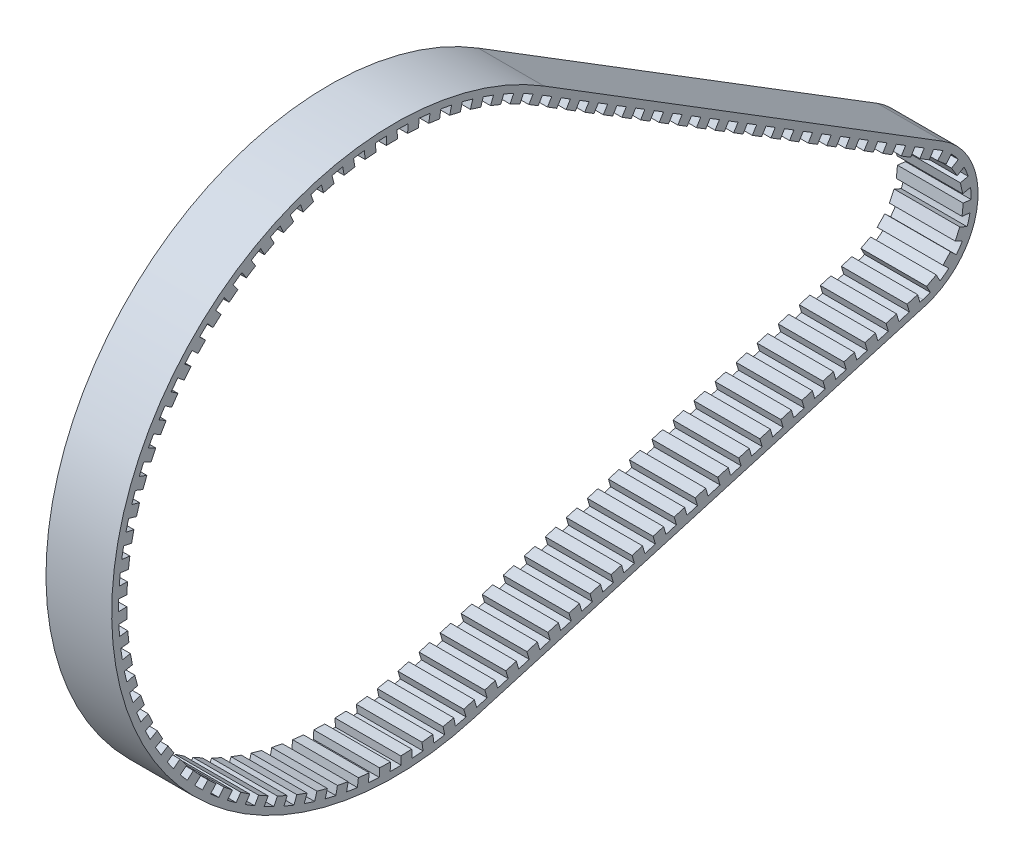
from build123d import *

# Parameters (mm, degrees)
BOSS_EXTRUDE1_DEPTH = 3
BOSS_EXTRUDE2_DEPTH = 6
CRVPATTERN1_START   = -3
CRVPATTERN1_DEPTH   = 6


# Read off the part's stored shape, not the designer's step: CrvPattern1
with BuildPart() as part:
    # Sketch1 → Boss-Extrude1 (new, symmetric)
    with BuildSketch(Plane(origin=(0, 0, 0), x_dir=(0, 0, -1), z_dir=(1, 0, 0))):
        with BuildLine():
            Line((48.384784727, -12.821103965), (7.22594026, -24.809098882))
            ThreePointArc((7.22594026, -24.809098882), (-25.602380983, 3.496239123), (13.61314313, 21.963331581))
            Line((13.61314313, 21.963331581), (50.050796621, -0.621174348))
            ThreePointArc((50.050796621, -0.621174348), (53.178020427, -7.261944725), (48.384784727, -12.821103965))
        make_face()
        with BuildLine():
            Line((13.281243742, 21.427847877), (49.718897234, -1.156658051))
            ThreePointArc((49.718897234, -1.156658051), (52.55381377, -7.176703601), (48.208610487, -12.216238165))
            Line((48.208610487, -12.216238165), (7.04976602, -24.204233081))
            ThreePointArc((7.04976602, -24.204233081), (-24.978174326, 3.410997999), (13.281243742, 21.427847877))
        make_face(mode=Mode.SUBTRACT)
    extrude(amount=BOSS_EXTRUDE1_DEPTH, both=True)

    # Sketch2 → Boss-Extrude2 (add)
    with BuildSketch(Plane(origin=(3, 0, 0), x_dir=(0, 0, -1), z_dir=(1, 0, 0))):
        Polygon((27.629188254, -18.210235623), (27.419457015, -17.490157289), (28.379561461, -17.210515638), (28.5892927, -17.930593972), align=None)
    extrude(amount=-BOSS_EXTRUDE2_DEPTH)

    # CrvPattern1 outline → CrvPattern1 (add)
    with BuildSketch(Plane.YZ.offset(CRVPATTERN1_START)):
        Polygon((-18.489877274, -26.669083808), (-17.76979894, -26.45935257), (-18.04944059, -25.499248124), (-18.769518925, -25.708979362), align=None)
        Polygon((-17.610652259, -29.687760899), (-17.331010608, -30.647865345), (-16.610932274, -30.438134107), (-16.890573925, -29.478029661), align=None)
        Polygon((-17.051368958, -31.607969791), (-16.771727307, -32.568074237), (-16.051648972, -32.358342998), (-16.331290623, -31.398238553), align=None)
        Polygon((-16.492085656, -33.528178683), (-16.212444005, -34.488283128), (-15.49236567, -34.27855189), (-15.772007321, -33.318447444), align=None)
        Polygon((-15.932802354, -35.448387574), (-15.653160703, -36.40849202), (-14.933082368, -36.198760782), (-15.212724019, -35.238656336), align=None)
        Polygon((-15.373519052, -37.368596466), (-15.093877401, -38.328700912), (-14.373799067, -38.118969674), (-14.653440717, -37.158865228), align=None)
        Polygon((-14.81423575, -39.288805358), (-14.534594099, -40.248909804), (-13.814515765, -40.039178566), (-14.094157416, -39.07907412), align=None)
        Polygon((-14.254952448, -41.20901425), (-13.975310797, -42.169118696), (-13.255232463, -41.959387458), (-13.534874114, -40.999283012), align=None)
        Polygon((-13.695669147, -43.129223142), (-13.416027496, -44.089327588), (-12.695949161, -43.879596349), (-12.975590812, -42.919491903), align=None)
        Polygon((-13.136385845, -45.049432033), (-12.856744194, -46.009536479), (-12.136665859, -45.799805241), (-12.41630751, -44.839700795), align=None)
        Polygon((-12.577102543, -46.969640925), (-12.297460892, -47.929745371), (-11.577382557, -47.720014133), (-11.857024208, -46.759909687), align=None)
        with BuildLine():
            ThreePointArc((-11.978971308, -48.87629586), (-11.76563246, -49.328961834), (-11.515966098, -49.762651418))
            Line((-11.515966098, -49.762651418), (-10.869363186, -49.424885705))
            Line((-10.869363186, -49.424885705), (-11.332368397, -48.538530147))
            Line((-11.332368397, -48.538530147), (-11.978971308, -48.87629586))
        make_face()
        with BuildLine():
            ThreePointArc((-10.916070269, -50.559938706), (-10.568518691, -50.919977382), (-10.192669716, -51.250367297))
            Line((-10.192669716, -51.250367297), (-9.688996971, -50.722641262))
            Line((-9.688996971, -50.722641262), (-10.412397524, -50.032212671))
            Line((-10.412397524, -50.032212671), (-10.916070269, -50.559938706))
        make_face()
        with BuildLine():
            ThreePointArc((-9.368284022, -51.81244403), (-8.923427297, -52.04162178), (-8.461308281, -52.233626893))
            Line((-8.461308281, -52.233626893), (-8.154052278, -51.571981405))
            Line((-8.154052278, -51.571981405), (-9.06102802, -51.150798542))
            Line((-9.06102802, -51.150798542), (-9.368284022, -51.81244403))
        make_face()
        with BuildLine():
            ThreePointArc((-7.499976804, -52.500804392), (-7.005055651, -52.57478412), (-6.505740451, -52.60801481))
            Line((-6.505740451, -52.60801481), (-6.427529661, -51.882712063))
            Line((-6.427529661, -51.882712063), (-7.421766015, -51.775501645))
            Line((-7.421766015, -51.775501645), (-7.499976804, -52.500804392))
        make_face()
        with BuildLine():
            ThreePointArc((-5.509549972, -52.551920667), (-5.017121608, -52.462846233), (-4.533634058, -52.33377363))
            Line((-4.533634058, -52.33377363), (-4.692773929, -51.621835779))
            Line((-4.692773929, -51.621835779), (-5.668689842, -51.839982815))
            Line((-5.668689842, -51.839982815), (-5.509549972, -52.551920667))
        make_face()
        with BuildLine():
            ThreePointArc((-3.608373142, -51.960364656), (-3.170730068, -51.717695153), (-2.754413216, -51.440025878))
            Line((-2.754413216, -51.440025878), (-3.134004188, -50.817055818))
            Line((-3.134004188, -50.817055818), (-3.987964115, -51.337394596))
            Line((-3.987964115, -51.337394596), (-3.608373142, -51.960364656))
        make_face()
        with BuildLine():
            ThreePointArc((-1.998338199, -50.788955534), (-1.661955094, -50.41846079), (-1.35701892, -50.021681408))
            Line((-1.35701892, -50.021681408), (-1.916751049, -49.553834269))
            Line((-1.916751049, -49.553834269), (-2.558070328, -50.321108394))
            Line((-2.558070328, -50.321108394), (-1.998338199, -50.788955534))
        make_face()
        Polygon((-0.821432921, -49.178047805), (-0.294608496, -48.328073672), (-0.932089095, -47.932955354), (-1.45891352, -48.782929486), align=None)
        Polygon((0.232215928, -47.47809954), (0.759040353, -46.628125407), (0.121559754, -46.233007089), (-0.405264671, -47.082981221), align=None)
        Polygon((1.285864777, -45.778151275), (1.812689202, -44.928177143), (1.175208603, -44.533058824), (0.648384178, -45.383032957), align=None)
        Polygon((2.339513626, -44.07820301), (2.866338051, -43.228228878), (2.228857452, -42.833110559), (1.702033027, -43.683084692), align=None)
        Polygon((3.393162476, -42.378254745), (3.9199869, -41.528280613), (3.282506301, -41.133162295), (2.755681876, -41.983136427), align=None)
        Polygon((4.446811325, -40.678306481), (4.973635749, -39.828332348), (4.33615515, -39.43321403), (3.809330725, -40.283188162), align=None)
        Polygon((5.500460174, -38.978358216), (6.027284598, -38.128384084), (5.389803999, -37.733265765), (4.862979574, -38.583239898), align=None)
        Polygon((6.554109023, -37.278409951), (7.080933447, -36.428435819), (6.443452848, -36.0333175), (5.916628423, -36.883291633), align=None)
        Polygon((7.607757872, -35.578461686), (8.134582296, -34.728487554), (7.497101697, -34.333369236), (6.970277272, -35.183343368), align=None)
        Polygon((8.661406721, -33.878513422), (9.188231145, -33.028539289), (8.550750546, -32.633420971), (8.023926122, -33.483395103), align=None)
        Polygon((9.71505557, -32.178565157), (10.241879994, -31.328591024), (9.604399395, -30.933472706), (9.077574971, -31.783446838), align=None)
        Polygon((10.768704419, -30.478616892), (11.295528843, -29.62864276), (10.658048244, -29.233524441), (10.13122382, -30.083498574), align=None)
        Polygon((11.822353268, -28.778668627), (12.349177692, -27.928694495), (11.711697093, -27.533576177), (11.184872669, -28.383550309), align=None)
        Polygon((12.876002117, -27.078720363), (13.402826542, -26.22874623), (12.765345942, -25.833627912), (12.238521518, -26.683602044), align=None)
        Polygon((13.929650966, -25.378772098), (14.456475391, -24.528797965), (13.818994791, -24.133679647), (13.292170367, -24.983653779), align=None)
        Polygon((14.983299815, -23.678823833), (15.510124239, -22.828849701), (14.87264364, -22.433731382), (14.345819216, -23.283705515), align=None)
        Polygon((16.036948664, -21.978875568), (16.563773088, -21.128901436), (15.926292489, -20.733783117), (15.399468065, -21.58375725), align=None)
        Polygon((17.090597513, -20.278927304), (17.617421938, -19.428953171), (16.979941339, -19.033834853), (16.453116914, -19.883808985), align=None)
        Polygon((18.144246362, -18.578979039), (18.671070787, -17.729004906), (18.033590188, -17.333886588), (17.506765763, -18.18386072), align=None)
        Polygon((19.197895211, -16.879030774), (19.724719635, -16.029056642), (19.087239037, -15.633938323), (18.560414612, -16.483912456), align=None)
        Polygon((20.25154406, -15.179082509), (20.778368485, -14.329108377), (20.140887886, -13.933990058), (19.614063461, -14.783964191), align=None)
        with BuildLine():
            ThreePointArc((21.427847877, -13.281243742), (21.627452786, -12.953663033), (21.822050163, -12.623083088))
            Line((21.822050163, -12.623083088), (21.184660236, -12.237310599))
            Line((21.184660236, -12.237310599), (20.666873423, -13.092820282))
            Line((20.666873423, -13.092820282), (21.305183386, -13.47914961))
            Line((21.305183386, -13.47914961), (21.427847877, -13.281243742))
        make_face()
        with BuildLine():
            ThreePointArc((22.305439851, -11.747827588), (22.534051701, -11.303124078), (22.753798601, -10.853973891))
            Line((22.753798601, -10.853973891), (22.087840803, -10.519928167))
            Line((22.087840803, -10.519928167), (21.639482054, -11.413781864))
            Line((21.639482054, -11.413781864), (22.305439851, -11.747827588))
        make_face()
        with BuildLine():
            ThreePointArc((23.166303548, -9.943162469), (23.358953421, -9.481740085), (23.542413826, -9.016587561))
            Line((23.542413826, -9.016587561), (22.85207738, -8.736369923))
            Line((22.85207738, -8.736369923), (22.475967103, -9.662944831))
            Line((22.475967103, -9.662944831), (23.166303548, -9.943162469))
        make_face()
        with BuildLine():
            ThreePointArc((23.881439164, -8.075949692), (24.036915192, -7.600711021), (24.182935039, -7.122482212))
            Line((24.182935039, -7.122482212), (23.47256252, -6.897855374))
            Line((23.47256252, -6.897855374), (23.171066644, -7.851322855))
            Line((23.171066644, -7.851322855), (23.881439164, -8.075949692))
        make_face()
        with BuildLine():
            ThreePointArc((24.446348123, -6.157934998), (24.563672281, -5.671869538), (24.671333031, -5.18357275))
            Line((24.671333031, -5.18357275), (23.945393049, -5.015949732))
            Line((23.945393049, -5.015949732), (23.720408141, -5.99031198))
            Line((23.720408141, -5.99031198), (24.446348123, -6.157934998))
        make_face()
        with BuildLine():
            ThreePointArc((24.857476854, -4.201183694), (24.935911113, -3.707349048), (25.004535523, -3.212055922))
            Line((25.004535523, -3.212055922), (24.267594619, -3.102491161))
            Line((24.267594619, -3.102491161), (24.12053595, -4.091618932))
            Line((24.12053595, -4.091618932), (24.857476854, -4.201183694))
        make_face()
        with BuildLine():
            ThreePointArc((25.112239145, -2.218004762), (25.151290111, -1.719507408), (25.180446499, -1.220333595))
            Line((25.180446499, -1.220333595), (24.437140414, -1.169516309))
            Line((24.437140414, -1.169516309), (24.368933059, -2.167187475))
            Line((24.368933059, -2.167187475), (25.112239145, -2.218004762))
        make_face()
        with BuildLine():
            ThreePointArc((25.209032407, -0.220873428), (25.208454431, 0.279150827), (25.197959388, 0.779065264))
            Line((25.197959388, 0.779065264), (24.452963902, 0.770815409))
            Line((24.452963902, 0.770815409), (24.464036922, -0.229123284))
            Line((24.464036922, -0.229123284), (25.209032407, -0.220873428))
        make_face()
        with BuildLine():
            ThreePointArc((25.147247762, 1.777647314), (25.107044479, 2.276053058), (25.056964023, 2.773563398))
            Line((25.056964023, 2.773563398), (24.314965547, 2.706298297))
            Line((24.314965547, 2.706298297), (24.405249285, 1.710382212))
            Line((24.405249285, 1.710382212), (25.147247762, 1.777647314))
        make_face()
        with BuildLine():
            ThreePointArc((24.927273867, 3.764985732), (24.847698176, 4.258637734), (24.75834734, 4.750614378))
            Line((24.75834734, 4.750614378), (24.024013428, 4.624757162))
            Line((24.024013428, 4.624757162), (24.192939955, 3.639128516))
            Line((24.192939955, 3.639128516), (24.927273867, 3.764985732))
        make_face()
        with BuildLine():
            ThreePointArc((24.550494471, 5.728640433), (24.432046945, 6.214433366), (24.303987793, 6.697781526))
            Line((24.303987793, 6.697781526), (23.581937787, 6.514123904))
            Line((23.581937787, 6.514123904), (23.828444465, 5.544982811))
            Line((23.828444465, 5.544982811), (24.550494471, 5.728640433))
        make_face()
        with BuildLine():
            ThreePointArc((24.019279713, 7.656259011), (23.862705449, 8.131136984), (23.696743538, 8.602816149))
            Line((23.696743538, 8.602816149), (22.991519508, 8.362513422))
            Line((22.991519508, 8.362513422), (23.314055683, 7.415956284))
            Line((23.314055683, 7.415956284), (24.019279713, 7.656259011))
        make_face()
        with BuildLine():
            ThreePointArc((23.33697121, 9.535715743), (23.14325514, 9.996691528), (22.940434458, 10.45373459))
            Line((22.940434458, 10.45373459), (22.256472629, 10.158298387))
            Line((22.256472629, 10.158298387), (22.653009381, 9.24027954))
            Line((22.653009381, 9.24027954), (23.33697121, 9.535715743))
        make_face()
        with BuildLine():
            ThreePointArc((22.507861037, 11.35518787), (22.278221736, 11.799361689), (22.03981813, 12.238893611))
            Line((22.03981813, 12.238893611), (21.381420977, 11.890182379))
            Line((21.381420977, 11.890182379), (21.849463884, 11.006476638))
            Line((21.849463884, 11.006476638), (22.507861037, 11.35518787))
        make_face()
        with BuildLine():
            ThreePointArc((21.537164726, 13.103229967), (21.273046746, 13.527807737), (21.000559897, 13.947063634))
            Line((21.000559897, 13.947063634), (20.371869081, 13.547270948))
            Line((20.371869081, 13.547270948), (20.90847391, 12.703437281))
            Line((20.90847391, 12.703437281), (21.537164726, 13.103229967))
        make_face()
        with BuildLine():
            ThreePointArc((20.430988463, 14.768845941), (20.134053242, 15.171156846), (19.829197235, 15.567499382))
            Line((19.829197235, 15.567499382), (19.234167547, 15.119140146))
            Line((19.234167547, 15.119140146), (19.835958775, 14.320486705))
            Line((19.835958775, 14.320486705), (20.430988463, 14.768845941))
        make_face()
        with BuildLine():
            ThreePointArc((19.19629067, 16.341558204), (18.868406085, 16.7190715), (18.533098623, 17.090007473))
            Line((18.533098623, 17.090007473), (17.975473109, 16.5959021))
            Line((17.975473109, 16.5959021), (18.638665156, 15.84745283))
            Line((18.638665156, 15.84745283), (19.19629067, 16.341558204))
        make_face()
        with BuildLine():
            ThreePointArc((17.840838238, 17.811473577), (17.484066853, 18.161814509), (17.120417194, 18.50501054))
            Line((17.120417194, 18.50501054), (16.603703609, 17.968267209))
            Line((16.603703609, 17.968267209), (17.324124652, 17.274730245))
            Line((17.324124652, 17.274730245), (17.840838238, 17.811473577))
        make_face()
        with BuildLine():
            ThreePointArc((16.373157666, 19.16934553), (15.989743759, 19.490310273), (15.600039448, 19.80360748))
            Line((15.600039448, 19.80360748), (15.127488188, 19.227602584))
            Line((15.127488188, 19.227602584), (15.900606406, 18.593340634))
            Line((15.900606406, 18.593340634), (16.373157666, 19.16934553))
        make_face()
        with BuildLine():
            ThreePointArc((14.802481429, 20.406632342), (14.394836872, 20.69620186), (13.981529352, 20.977629442))
            Line((13.981529352, 20.977629442), (13.556113009, 20.365986352))
            Line((13.556113009, 20.365986352), (14.377065086, 19.794989253))
            Line((14.377065086, 19.794989253), (14.802481429, 20.406632342))
        make_face()
        with BuildLine():
            ThreePointArc((13.138689894, 21.515550838), (12.709378984, 21.771903588), (12.275068173, 22.019691218))
            Line((12.275068173, 22.019691218), (11.899462838, 21.376257487))
            Line((11.899462838, 21.376257487), (12.763084559, 20.872117107))
            Line((12.763084559, 20.872117107), (13.138689894, 21.515550838))
        make_face()
        with BuildLine():
            ThreePointArc((11.392249176, 22.489125343), (10.943972501, 22.710648734), (10.49139044, 22.9232377))
            Line((10.49139044, 22.9232377), (10.167958865, 22.25206086))
            Line((10.167958865, 22.25206086), (11.068817601, 21.817948504))
            Line((11.068817601, 21.817948504), (11.392249176, 22.489125343))
        make_face()
        with BuildLine():
            ThreePointArc((9.574145293, 23.321231569), (9.109722746, 23.506532103), (8.641716412, 23.682585109))
            Line((8.641716412, 23.682585109), (8.37249315, 22.987887212))
            Line((8.37249315, 22.987887212), (9.304922031, 22.626533672))
            Line((9.304922031, 22.626533672), (9.574145293, 23.321231569))
        make_face()
        with BuildLine():
            ThreePointArc((7.695815063, 24.006635135), (7.218168103, 24.154547175), (6.737681498, 24.292956758))
            Line((6.737681498, 24.292956758), (6.524360104, 23.579107813))
            Line((6.524360104, 23.579107813), (7.482493669, 23.29278619))
            Line((7.482493669, 23.29278619), (7.695815063, 24.006635135))
        make_face()
        with BuildLine():
            ThreePointArc((5.769074159, 24.541024497), (5.281207434, 24.6506176), (4.791263069, 24.75051309))
            Line((4.791263069, 24.75051309), (4.635185444, 24.022003578))
            Line((4.635185444, 24.022003578), (5.612996534, 23.812514985))
            Line((5.612996534, 23.812514985), (5.769074159, 24.541024497))
        make_face()
        with BuildLine():
            ThreePointArc((3.806042783, 24.921038067), (3.311025227, 24.991622836), (2.814705106, 25.052375839))
            Line((2.814705106, 25.052375839), (2.716853059, 24.313788464))
            Line((2.716853059, 24.313788464), (3.708190736, 24.182450692))
            Line((3.708190736, 24.182450692), (3.806042783, 24.921038067))
        make_face()
        with BuildLine():
            ThreePointArc((1.81906942, 25.144285364), (1.320014952, 25.175417783), (0.820441186, 25.196646131))
            Line((0.820441186, 25.196646131), (0.781430258, 24.452626991))
            Line((0.781430258, 24.452626991), (1.780058493, 24.400266223))
            Line((1.780058493, 24.400266223), (1.81906942, 25.144285364))
        make_face()
        with BuildLine():
            ThreePointArc((-0.179346835, 25.209362045), (-0.679298904, 25.200846276), (-1.178983736, 25.182416432))
            Line((-1.178983736, 25.182416432), (-1.158908145, 24.437645793))
            Line((-1.158908145, 24.437645793), (-0.159271244, 24.464591406))
            Line((-0.159271244, 24.464591406), (-0.179346835, 25.209362045))
        make_face()
        with BuildLine():
            ThreePointArc((-2.176634904, 25.115858745), (-2.674339616, 25.067748356), (-3.170992237, 25.009776253))
            Line((-3.170992237, 25.009776253), (-3.091956414, 24.26893911))
            Line((-3.091956414, 24.26893911), (-2.097599081, 24.375021602))
            Line((-2.097599081, 24.375021602), (-2.176634904, 25.115858745))
        make_face()
        with BuildLine():
            ThreePointArc((-4.16023081, 24.864363648), (-4.652557344, 24.776961278), (-5.14305355, 24.679811591))
            Line((-5.14305355, 24.679811591), (-5.005554671, 23.947568195))
            Line((-5.005554671, 23.947568195), (-4.022731931, 24.132120251))
            Line((-4.022731931, 24.132120251), (-4.16023081, 24.864363648))
        make_face()
        with BuildLine():
            ThreePointArc((-6.117656703, 24.456458788), (-6.601508069, 24.330314244), (-7.082762385, 24.194598096))
            Line((-7.082762385, 24.194598096), (-6.88766539, 23.475554636))
            Line((-6.88766539, 23.475554636), (-5.922559708, 23.737415329))
            Line((-5.922559708, 23.737415329), (-6.117656703, 24.456458788))
        make_face()
        with BuildLine():
            ThreePointArc((-8.036599357, 23.8947101), (-8.508931878, 23.730616897), (-8.977916965, 23.557188011))
            Line((-8.977916965, 23.557188011), (-8.726449115, 22.855867646))
            Line((-8.726449115, 22.855867646), (-7.785131507, 23.193389735))
            Line((-7.785131507, 23.193389735), (-8.036599357, 23.8947101))
        make_face()
        with BuildLine():
            ThreePointArc((-9.904987627, 23.182651274), (-10.362830087, 22.981641643), (-10.816595785, 22.771590977))
            Line((-10.816595785, 22.771590977), (-10.510338943, 22.092405376))
            Line((-10.510338943, 22.092405376), (-9.598730786, 22.503465673))
            Line((-9.598730786, 22.503465673), (-9.904987627, 23.182651274))
        make_face()
        with BuildLine():
            ThreePointArc((-11.711068381, 22.32476153), (-12.151540712, 22.088099926), (-12.587232598, 21.842748809))
            Line((-12.587232598, 21.842748809), (-12.22811328, 21.189970401))
            Line((-12.22811328, 21.189970401), (-11.351949062, 21.671983123))
            Line((-11.351949062, 21.671983123), (-11.711068381, 22.32476153))
        make_face()
        with BuildLine():
            ThreePointArc((-13.443480431, 21.32643744), (-13.863811835, 21.055612587), (-14.278689181, 20.776504405))
            Line((-14.278689181, 20.776504405), (-13.868966433, 20.154239507))
            Line((-13.868966433, 20.154239507), (-13.033757683, 20.704172542))
            Line((-13.033757683, 20.704172542), (-13.443480431, 21.32643744))
        make_face()
        with BuildLine():
            ThreePointArc((-15.091326007, 20.193958982), (-15.488872379, 19.890674509), (-15.880325392, 19.579564996))
            Line((-15.880325392, 19.579564996), (-15.422576583, 18.991727977))
            Line((-15.422576583, 18.991727977), (-14.633577197, 19.606121963))
            Line((-14.633577197, 19.606121963), (-15.091326007, 20.193958982))
        make_face()
        with BuildLine():
            ThreePointArc((-16.644239303, 18.934450032), (-17.016499872, 18.600613756), (-17.382066108, 18.259459954))
            Line((-17.382066108, 18.259459954), (-16.879170716, 17.709748614))
            Line((-16.879170716, 17.709748614), (-16.14134391, 18.384738692))
            Line((-16.14134391, 18.384738692), (-16.644239303, 18.934450032))
        make_face()
        with BuildLine():
            ThreePointArc((-18.092451689, 17.555833557), (-18.437084741, 17.193545482), (-18.7744646, 16.824493425))
            Line((-18.7744646, 16.824493425), (-18.229586097, 16.316365733))
            Line((-18.229586097, 16.316365733), (-17.547573186, 17.047705865))
            Line((-17.547573186, 17.047705865), (-18.092451689, 17.555833557))
        make_face()
        with BuildLine():
            ThreePointArc((-19.426853156, 16.06678177), (-19.741690771, 15.678320876), (-20.048761957, 15.283692093))
            Line((-20.048761957, 15.283692093), (-19.465327914, 14.820344436))
            Line((-19.465327914, 14.820344436), (-18.843419112, 15.603434114))
            Line((-18.843419112, 15.603434114), (-19.426853156, 16.06678177))
        make_face()
        with BuildLine():
            ThreePointArc((-20.639049626, 14.476661581), (-20.922111312, 14.064471489), (-21.196942188, 13.646748399))
            Line((-21.196942188, 13.646748399), (-20.578622707, 13.231095476))
            Line((-20.578622707, 13.231095476), (-20.020730145, 14.061008658))
            Line((-20.020730145, 14.061008658), (-20.639049626, 14.476661581))
        make_face()
        with BuildLine():
            ThreePointArc((-21.721415754, 12.79547567), (-21.970920906, 12.362149269), (-22.211782643, 11.923959569))
            Line((-22.211782643, 11.923959569), (-21.562467274, 11.558616052))
            Line((-21.562467274, 11.558616052), (-21.072100385, 12.430132153))
            Line((-21.072100385, 12.430132153), (-21.721415754, 12.79547567))
        make_face()
        with BuildLine():
            ThreePointArc((-22.667142895, 11.033799572), (-22.881521994, 10.58206271), (-23.086899448, 10.12616284))
            Line((-23.086899448, 10.12616284), (-22.410672723, 9.81342693))
            Line((-22.410672723, 9.81342693), (-21.990916169, 10.721063661))
            Line((-21.990916169, 10.721063661), (-22.667142895, 11.033799572))
        make_face()
        with BuildLine():
            ThreePointArc((-23.470281933, 9.202715143), (-23.648186425, 8.735409481), (-23.816787664, 8.264667288))
            Line((-23.816787664, 8.264667288), (-23.1179034, 8.006506255))
            Line((-23.1179034, 8.006506255), (-22.771397668, 8.94455411))
            Line((-22.771397668, 8.94455411), (-23.470281933, 9.202715143))
        make_face()
        with BuildLine():
            ThreePointArc((-24.125780706, 7.313740855), (-24.26609148, 6.833805988), (-24.396855914, 6.351182685))
            Line((-24.396855914, 6.351182685), (-23.679710456, 6.149220497))
            Line((-23.679710456, 6.149220497), (-23.408635248, 7.111778668))
            Line((-23.408635248, 7.111778668), (-24.125780706, 7.313740855))
        make_face()
        with BuildLine():
            ThreePointArc((-24.629515788, 5.378759339), (-24.731350215, 4.889214306), (-24.823455269, 4.397745844))
            Line((-24.823455269, 4.397745844), (-24.092559834, 4.253252948))
            Line((-24.092559834, 4.253252948), (-23.898620353, 5.234266443))
            Line((-23.898620353, 5.234266443), (-24.629515788, 5.378759339))
        make_face()
        with BuildLine():
            ThreePointArc((-24.978318423, 3.409942633), (-25.041035911, 2.913866927), (-25.093902196, 2.416644898))
            Line((-25.093902196, 2.416644898), (-24.353854497, 2.330530229))
            Line((-24.353854497, 2.330530229), (-24.238270723, 3.323827964))
            Line((-24.238270723, 3.323827964), (-24.978318423, 3.409942633))
        make_face()
        with BuildLine():
            ThreePointArc((-25.16999446, 1.419675617), (-25.193200485, 0.920189811), (-25.206495444, 0.420342))
            Line((-25.206495444, 0.420342), (-24.461950765, 0.393147264))
            Line((-24.461950765, 0.393147264), (-24.425449781, 1.392480881))
            Line((-24.425449781, 1.392480881), (-25.16999446, 1.419675617))
        make_face()
        with BuildLine():
            ThreePointArc((-25.203338159, -0.579521897), (-25.186886742, -1.079275777), (-25.160526744, -1.578605068))
            Line((-25.160526744, -1.578605068), (-24.416168657, -1.546708801))
            Line((-24.416168657, -1.546708801), (-24.458980072, -0.54762563))
            Line((-24.458980072, -0.54762563), (-25.203338159, -0.579521897))
        make_face()
        with BuildLine():
            ThreePointArc((-25.07813977, -2.575073916), (-25.0221344, -3.071952159), (-24.956285261, -3.567621889))
            Line((-24.956285261, -3.567621889), (-24.216796166, -3.476835265))
            Line((-24.216796166, -3.476835265), (-24.338650674, -2.484287292))
            Line((-24.338650674, -2.484287292), (-25.07813977, -2.575073916))
        make_face()
        with BuildLine():
            ThreePointArc((-24.795186855, -4.554427384), (-24.699979834, -5.045304367), (-24.595055782, -5.534196516))
            Line((-24.595055782, -5.534196516), (-23.865087448, -5.385090629))
            Line((-23.865087448, -5.385090629), (-24.065218522, -4.405321496))
            Line((-24.065218522, -4.405321496), (-24.795186855, -4.554427384))
        make_face()
        with BuildLine():
            Line((-24.204233081, -7.04976602), (-24.082709862, -7.466996365))
            Line((-24.082709862, -7.466996365), (-23.363254935, -7.259470975))
            Line((-23.363254935, -7.259470975), (-23.640403645, -6.29864394))
            Line((-23.640403645, -6.29864394), (-24.356259337, -6.505131137))
            ThreePointArc((-24.356259337, -6.505131137), (-24.281773262, -6.777874831), (-24.204233081, -7.04976602))
        make_face()
        Polygon((-23.803068641, -8.427099335), (-23.52342699, -9.387203781), (-22.803348656, -9.177472543), (-23.082990307, -8.217368097), align=None)
        Polygon((-23.24378534, -10.347308227), (-22.964143689, -11.307412673), (-22.244065354, -11.097681435), (-22.523707005, -10.137576989), align=None)
        Polygon((-22.684502038, -12.267517119), (-22.404860387, -13.227621565), (-21.684782053, -13.017890327), (-21.964423704, -12.057785881), align=None)
        Polygon((-22.125218736, -14.187726011), (-21.845577085, -15.147830457), (-21.125498751, -14.938099219), (-21.405140402, -13.977994773), align=None)
        Polygon((-21.565935434, -16.107934903), (-21.286293783, -17.068039349), (-20.566215449, -16.85830811), (-20.8458571, -15.898203664), align=None)
        Polygon((-21.006652132, -18.028143794), (-20.727010481, -18.98824824), (-20.006932147, -18.778517002), (-20.286573798, -17.818412556), align=None)
        Polygon((-20.44736883, -19.948352686), (-20.16772718, -20.908457132), (-19.447648845, -20.698725894), (-19.727290496, -19.738621448), align=None)
        Polygon((-19.888085529, -21.868561578), (-19.608443878, -22.828666024), (-18.888365543, -22.618934786), (-19.168007194, -21.65883034), align=None)
        Polygon((-19.328802227, -23.78877047), (-19.049160576, -24.748874916), (-18.329082241, -24.539143678), (-18.608723892, -23.579039232), align=None)
    extrude(amount=CRVPATTERN1_DEPTH)


solid = part.part
